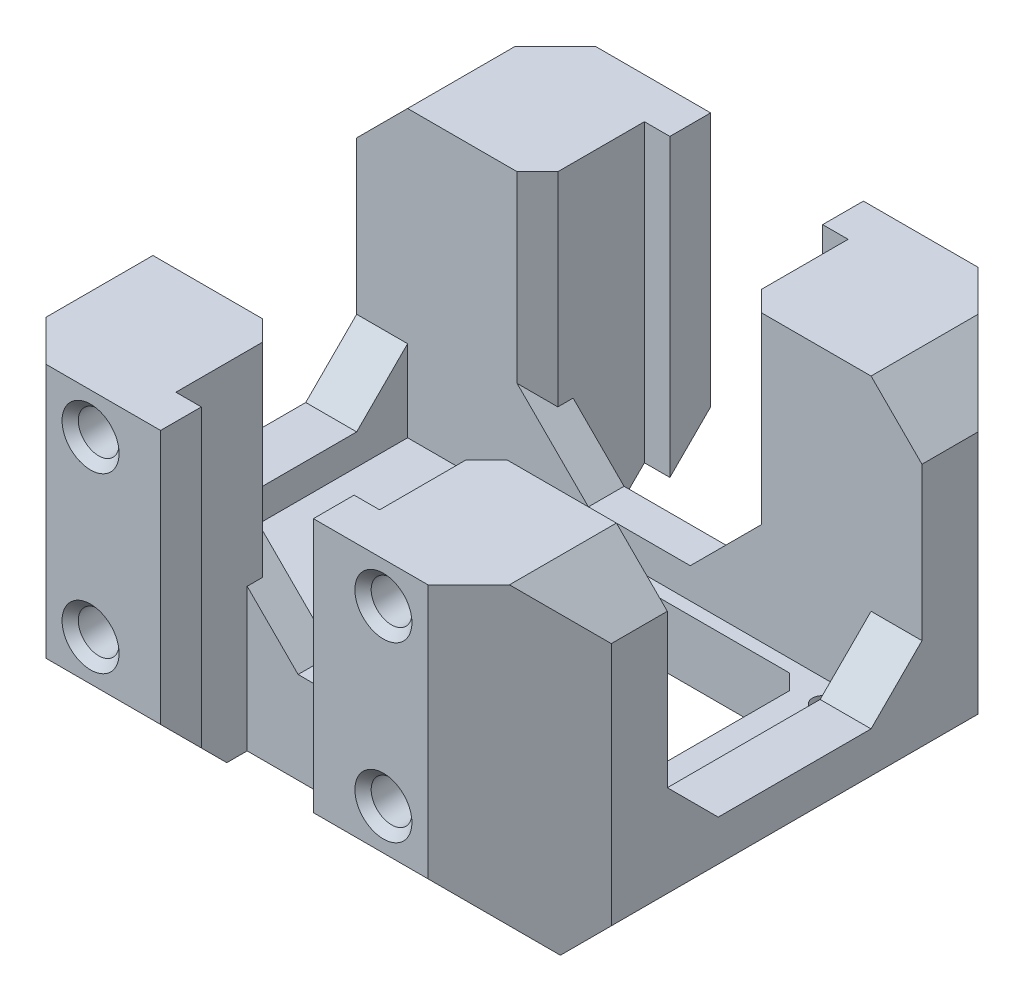
from build123d import *

# Parameters (mm, degrees)
SKETCH1_W           = 55.5
SKETCH1_H           = 35
SKETCH1_W_2         = 45.5
SKETCH1_H_2         = 25
BOSS_EXTRUDE1_DEPTH = 28
SKETCH2_W           = 55.5
SKETCH2_H           = 35
BOSS_EXTRUDE2_DEPTH = 6
SKETCH4_R           = 1
CUT_EXTRUDE1_DEPTH  = 3.5
CUT_EXTRUDE2_REACH  = 47.481
SKETCH5_R           = 2
CUT_EXTRUDE3_REACH  = 45.131
SKETCH6_W           = 19.25
SKETCH6_H           = 22.5
CHAMFER1_SIZE       = 1.5
CUT_EXTRUDE4_REACH  = 45.131
SKETCH7_R           = 3
CHAMFER2_SIZE       = 1
SKETCH8_W           = 55.5
SKETCH8_H           = 9.5
BOSS_EXTRUDE3_DEPTH = 34
CUT_EXTRUDE5_REACH  = 53.527
SKETCH10_W          = 20
SKETCH10_H          = 7
SKETCH10_W_2        = 15
SKETCH10_H_2        = 4
CHAMFER7_SIZE       = 9
CHAMFER8_SIZE       = 5
CHAMFER9_SIZE       = 5
SKETCH12_R          = 1.45
CUT_EXTRUDE7_DEPTH  = 10
CUT_EXTRUDE8_REACH  = 57.806
SKETCH13_W          = 20
SKETCH13_H          = 25
CUT_EXTRUDE9_REACH  = 65.744
SKETCH14_W          = 25
SKETCH14_H          = 25
CHAMFER10_SIZE      = 5
CHAMFER11_SIZE      = 2
SKETCH15_R          = 2
CUT_EXTRUDE10_DEPTH = 5.2
CHAMFER12_SIZE      = 0.8


# Some blends are built 0.0001 mm under size
with BuildPart() as part:
    # Sketch1 → Boss-Extrude1 (new body)
    with BuildSketch(Plane(origin=(0, 0, 0), x_dir=(1, 0, 0), z_dir=(0, 1, 0))):
        Rectangle(SKETCH1_W, SKETCH1_H)
        Rectangle(SKETCH1_W_2, SKETCH1_H_2, mode=Mode.SUBTRACT)
    extrude(amount=BOSS_EXTRUDE1_DEPTH)

    # Sketch2 → Boss-Extrude2 (add)
    with BuildSketch(Plane.XZ):
        Rectangle(SKETCH2_W, SKETCH2_H)
    extrude(amount=BOSS_EXTRUDE2_DEPTH)

    # Sketch4 → Cut-Extrude1 (cut)
    with BuildSketch(Plane(origin=(0, 0, 0), x_dir=(1, 0, 0), z_dir=(0, 1, 0))):
        with Locations(Location((-4.2, 10.25, 0), (0, 0, 270))):
            Circle(SKETCH4_R)
        with Locations(Location((20.25, 10.25, 0), (0, 0, 270))):
            Circle(SKETCH4_R)
        with Locations(Location((20.25, -10.25, 0), (0, 0, 270))):
            Circle(SKETCH4_R)
        with Locations(Location((-4.2, -10.25, 0), (0, 0, 270))):
            Circle(SKETCH4_R)
    extrude(amount=-CUT_EXTRUDE1_DEPTH, mode=Mode.SUBTRACT)

    # Sketch5 → Cut-Extrude2 (cut, up to next)
    with BuildSketch(Plane(origin=(0, -3.5, 0), x_dir=(1, 0, 0), z_dir=(0, 1, 0)), mode=Mode.PRIVATE) as cut_extrude2_sk1:
        with Locations(Location((-4.2, 10.25, 0), (0, 0, 270))):
            Circle(SKETCH5_R)
    cut_extrude2_tool1 = extrude(cut_extrude2_sk1.sketch, amount=-CUT_EXTRUDE2_REACH, mode=Mode.PRIVATE) & part.part
    # Sketch5 → Cut-Extrude2 (cut, up to next)
    with BuildSketch(Plane(origin=(0, -3.5, 0), x_dir=(1, 0, 0), z_dir=(0, 1, 0)), mode=Mode.PRIVATE) as cut_extrude2_sk2:
        with Locations(Location((20.25, 10.25, 0), (0, 0, 270))):
            Circle(SKETCH5_R)
    cut_extrude2_tool2 = extrude(cut_extrude2_sk2.sketch, amount=-CUT_EXTRUDE2_REACH, mode=Mode.PRIVATE) & part.part
    # Sketch5 → Cut-Extrude2 (cut, up to next)
    with BuildSketch(Plane(origin=(0, -3.5, 0), x_dir=(1, 0, 0), z_dir=(0, 1, 0)), mode=Mode.PRIVATE) as cut_extrude2_sk3:
        with Locations(Location((20.25, -10.25, 0), (0, 0, 270))):
            Circle(SKETCH5_R)
    cut_extrude2_tool3 = extrude(cut_extrude2_sk3.sketch, amount=-CUT_EXTRUDE2_REACH, mode=Mode.PRIVATE) & part.part
    # Sketch5 → Cut-Extrude2 (cut, up to next)
    with BuildSketch(Plane(origin=(0, -3.5, 0), x_dir=(1, 0, 0), z_dir=(0, 1, 0)), mode=Mode.PRIVATE) as cut_extrude2_sk4:
        with Locations(Location((-4.2, -10.25, 0), (0, 0, 270))):
            Circle(SKETCH5_R)
    cut_extrude2_tool4 = extrude(cut_extrude2_sk4.sketch, amount=-CUT_EXTRUDE2_REACH, mode=Mode.PRIVATE) & part.part
    add(cut_extrude2_tool1.solids().sort_by_distance((-4.2, -3.5, -10.25))[0], mode=Mode.SUBTRACT)
    add(cut_extrude2_tool2.solids().sort_by_distance((20.25, -3.5, -10.25))[0], mode=Mode.SUBTRACT)
    add(cut_extrude2_tool3.solids().sort_by_distance((20.25, -3.5, 10.25))[0], mode=Mode.SUBTRACT)
    add(cut_extrude2_tool4.solids().sort_by_distance((-4.2, -3.5, 10.25))[0], mode=Mode.SUBTRACT)

    # Sketch6 → Cut-Extrude3 (cut, up to next)
    with BuildSketch(Plane(origin=(0, 0, 0), x_dir=(1, 0, 0), z_dir=(0, 1, 0)), mode=Mode.PRIVATE) as cut_extrude3_sk1:
        with Locations((7.875, 0)):
            Rectangle(SKETCH6_W, SKETCH6_H)
    cut_extrude3_tool1 = extrude(cut_extrude3_sk1.sketch, amount=-CUT_EXTRUDE3_REACH, mode=Mode.PRIVATE) & part.part
    add(cut_extrude3_tool1.solids().sort_by_distance((7.875, 0, 0))[0], mode=Mode.SUBTRACT)

    # Chamfer1
    chamfer1_edges = [part.edges().sort_by_distance(p)[0] for p in [
        (17.5, -3, -11.25),
        (17.5, -3, 11.25),
        (-1.75, -3, 11.25),
        (-1.75, -3, -11.25),
    ]]
    chamfer(chamfer1_edges, length=CHAMFER1_SIZE)

    # Sketch7 → Cut-Extrude4 (cut, up to next)
    with BuildSketch(Plane(origin=(0, 0, 0), x_dir=(1, 0, 0), z_dir=(0, 1, 0)), mode=Mode.PRIVATE) as cut_extrude4_sk1:
        with Locations(Location((-12.5, 0, 0), (0, 0, 270))):
            Circle(SKETCH7_R)
    cut_extrude4_tool1 = extrude(cut_extrude4_sk1.sketch, amount=-CUT_EXTRUDE4_REACH, mode=Mode.PRIVATE) & part.part
    add(cut_extrude4_tool1.solids().sort_by_distance((-12.5, 0, 0))[0], mode=Mode.SUBTRACT)

    # Chamfer2
    chamfer2_edges = [part.edges().sort_by_distance(p)[0] for p in [
        (-12.5, 0, -3),
        (-12.5, -6, -3),
    ]]
    chamfer(chamfer2_edges, length=CHAMFER2_SIZE)

    # Sketch8 → Boss-Extrude3 (add)
    with BuildSketch(Plane(origin=(0, 28, 0), x_dir=(1, 0, 0), z_dir=(0, 1, 0))):
        with Locations((0, -22.25)):
            Rectangle(SKETCH8_W, SKETCH8_H)
    boss_extrude3 = extrude(amount=-BOSS_EXTRUDE3_DEPTH)

    # Sketch10 → Cut-Extrude5 (cut, up to next)
    with BuildSketch(Plane(origin=(0, 28, 0), x_dir=(1, 0, 0), z_dir=(0, 1, 0)), mode=Mode.PRIVATE) as cut_extrude5_sk1:
        with Locations((0, -19.5)):
            Rectangle(SKETCH10_W, SKETCH10_H)
    cut_extrude5_tool1 = extrude(cut_extrude5_sk1.sketch, amount=-CUT_EXTRUDE5_REACH, mode=Mode.PRIVATE) & part.part
    # Sketch10 → Cut-Extrude5 (cut, up to next)
    with BuildSketch(Plane(origin=(0, 28, 0), x_dir=(1, 0, 0), z_dir=(0, 1, 0)), mode=Mode.PRIVATE) as cut_extrude5_sk2:
        with Locations((0, -25)):
            Rectangle(SKETCH10_W_2, SKETCH10_H_2)
    cut_extrude5_tool2 = extrude(cut_extrude5_sk2.sketch, amount=-CUT_EXTRUDE5_REACH, mode=Mode.PRIVATE) & part.part
    cut_extrude5_1 = cut_extrude5_tool1.solids().sort_by_distance((0, 28, 19.5))[0]
    add(cut_extrude5_1, mode=Mode.SUBTRACT)
    cut_extrude5_2 = cut_extrude5_tool2.solids().sort_by_distance((0, 28, 25))[0]
    add(cut_extrude5_2, mode=Mode.SUBTRACT)
    cut_extrude5 = cut_extrude5_1 + cut_extrude5_2  # Cut-Extrude5 as one shape, for the pattern or mirror that repeats it

    # Mirror3: Boss-Extrude3, Cut-Extrude5 across plane
    add(boss_extrude3.mirror(Plane.XY))
    add(cut_extrude5.mirror(Plane.XY), mode=Mode.SUBTRACT)

    # Chamfer7
    chamfer7_edges = [part.edges().sort_by_distance(p)[0] for p in [
        (17.625, -6, -27),
        (-27.75, 11, -27),
        (27.75, 11, -27),
        (-17.625, -6, -27),
        (17.625, -6, 27),
        (27.75, 11, 27),
        (-17.625, -6, 27),
        (-27.75, 11, 27),
    ]]
    chamfer(chamfer7_edges, length=CHAMFER7_SIZE)

    # Chamfer8
    chamfer8_edges = [part.edges().sort_by_distance(p)[0] for p in [
        (27.75, 28, 0),
        (-27.75, 28, 0),
    ]]
    chamfer(chamfer8_edges, length=CHAMFER8_SIZE - 0.0001)  # a hair under: the kernel refuses the full size

    # Chamfer9
    chamfer9_edges = [part.edges().sort_by_distance(p)[0] for p in [
        (27.75, -6, 0),
        (-27.75, -6, 0),
    ]]
    chamfer(chamfer9_edges, length=CHAMFER9_SIZE)

    # Sketch12 → Cut-Extrude7 (cut)
    with BuildSketch(Plane(origin=(0, 0, -27), x_dir=(-1, 0, 0), z_dir=(0, 0, -1))):
        with Locations((-14.375, 24)):
            Circle(SKETCH12_R)
        with Locations((14.375, 24)):
            Circle(SKETCH12_R)
        with Locations((14.375, 7)):
            Circle(SKETCH12_R)
        with Locations((-14.375, 7)):
            Circle(SKETCH12_R)
    cut_extrude7 = extrude(amount=-CUT_EXTRUDE7_DEPTH, mode=Mode.SUBTRACT)

    # Mirror4: Cut-Extrude7 across plane
    add(cut_extrude7.mirror(Plane.XY), mode=Mode.SUBTRACT)

    # Sketch13 → Cut-Extrude8 (cut, up to next)
    with BuildSketch(Plane.XY.offset(-12.5), mode=Mode.PRIVATE) as cut_extrude8_sk1:
        with Locations((0, 15.5)):
            Rectangle(SKETCH13_W, SKETCH13_H)
    cut_extrude8_tool1 = extrude(cut_extrude8_sk1.sketch, amount=-CUT_EXTRUDE8_REACH, mode=Mode.PRIVATE) & part.part
    cut_extrude8 = cut_extrude8_tool1.solids().sort_by_distance((0, 15.5, -12.5))[0]
    add(cut_extrude8, mode=Mode.SUBTRACT)

    # Sketch14 → Cut-Extrude9 (cut, up to next)
    with BuildSketch(Plane.ZY.offset(-22.75), mode=Mode.PRIVATE) as cut_extrude9_sk1:
        with Locations((0, 15.5)):
            Rectangle(SKETCH14_W, SKETCH14_H)
    cut_extrude9_tool1 = extrude(cut_extrude9_sk1.sketch, amount=-CUT_EXTRUDE9_REACH, mode=Mode.PRIVATE) & part.part
    cut_extrude9 = cut_extrude9_tool1.solids().sort_by_distance((22.75, 15.5, 0))[0]
    add(cut_extrude9, mode=Mode.SUBTRACT)

    # Mirror5: Cut-Extrude9 across plane
    add(cut_extrude9.mirror(Plane(origin=(0, 0, 0), x_dir=(0, 0, 1), z_dir=(1, 0, 0))), mode=Mode.SUBTRACT)

    # Mirror6: Cut-Extrude8 across plane
    add(cut_extrude8.mirror(Plane.XY), mode=Mode.SUBTRACT)

    # Chamfer10
    # the kernel refuses this chamfer: 5 mm, written as the material it adds along each edge
    with BuildSketch(Plane(origin=(-10, 3, -12.5), x_dir=(0.9996219169112968, -0.027495876610586403, 0), z_dir=(0, 0, -1)), Plane(origin=(10, 3, -12.5), x_dir=(0.027495876610586327, 0.9996219169112968, 0), z_dir=(0, 0, -1)), Plane(origin=(-10, 3, 12.5), x_dir=(-0.027495876610586317, 0.9996219169112968, 0), z_dir=(0, 0, 1))) as chamfer10_piece_1:
        Polygon((CHAMFER10_SIZE * 0.999621916911, -CHAMFER10_SIZE * 0.0274958766106), (-CHAMFER10_SIZE * 0.0274958766106, -CHAMFER10_SIZE * 0.999621916911), (0, 0), align=None)
    extrude(amount=3.5)
    with BuildSketch(Plane(origin=(22.75, 3, -12.5), x_dir=(0, -0.027495876610586403, 0.9996219169112968), z_dir=(1, 0, 0))) as chamfer10_piece_2:
        Polygon((CHAMFER10_SIZE * 0.999621916911, -CHAMFER10_SIZE * 0.0274958766106), (-CHAMFER10_SIZE * 0.0274958766106, -CHAMFER10_SIZE * 0.999621916911), (0, 0), align=None)
    extrude(amount=5)
    with BuildSketch(Plane(origin=(22.75, 3, 12.5), x_dir=(0, -0.027495876610586403, -0.9996219169112968), z_dir=(1, 0, 0)), Plane(origin=(-22.75, 3, -12.5), x_dir=(0, -0.027495876610586403, 0.9996219169112968), z_dir=(-1, 0, 0)), Plane(origin=(-22.75, 3, 12.5), x_dir=(0, 0.9996219169112968, 0.027495876610586327), z_dir=(-1, 0, 0))) as chamfer10_piece_3:
        Polygon((CHAMFER10_SIZE * 0.999621916911, CHAMFER10_SIZE * 0.0274958766106), (-CHAMFER10_SIZE * 0.0274958766106, CHAMFER10_SIZE * 0.999621916911), (0, 0), align=None)
    extrude(amount=5)
    with BuildSketch(Plane(origin=(10, 3, 12.5), x_dir=(0.027495876610586327, 0.9996219169112968, 0), z_dir=(0, 0, 1))) as chamfer10_piece_4:
        Polygon((CHAMFER10_SIZE * 0.999621916911, CHAMFER10_SIZE * 0.0274958766106), (-CHAMFER10_SIZE * 0.0274958766106, CHAMFER10_SIZE * 0.999621916911), (0, 0), align=None)
    extrude(amount=3.5)

    # Chamfer11
    chamfer11_edges = [part.edges().sort_by_distance(p)[0] for p in [
        (-10, 18, -12.5),
        (-10, 18, 12.5),
        (10, 18, 12.5),
        (10, 18, -12.5),
    ]]
    chamfer(chamfer11_edges, length=CHAMFER11_SIZE)

    # Sketch15 → Cut-Extrude10 (cut)
    with BuildSketch(Plane(origin=(0, 0, -27), x_dir=(-1, 0, 0), z_dir=(0, 0, -1))):
        with Locations((-14.375, 24)):
            Circle(SKETCH15_R)
        with Locations((14.375, 24)):
            Circle(SKETCH15_R)
        with Locations((14.375, 7)):
            Circle(SKETCH15_R)
        with Locations((-14.375, 7)):
            Circle(SKETCH15_R)
    cut_extrude10 = extrude(amount=-CUT_EXTRUDE10_DEPTH, mode=Mode.SUBTRACT)

    # Mirror7: Cut-Extrude10 across plane
    add(cut_extrude10.mirror(Plane.XY), mode=Mode.SUBTRACT)

    # Chamfer12
    chamfer12_edges = [part.edges().sort_by_distance(p)[0] for p in [
        (16.375, 7, -27),
        (-12.375, 7, -27),
        (-12.375, 24, -27),
        (16.375, 24, -27),
        (16.375, 7, 27),
        (-12.375, 7, 27),
        (-12.375, 24, 27),
        (16.375, 24, 27),
    ]]
    chamfer(chamfer12_edges, length=CHAMFER12_SIZE)


solid = part.part
